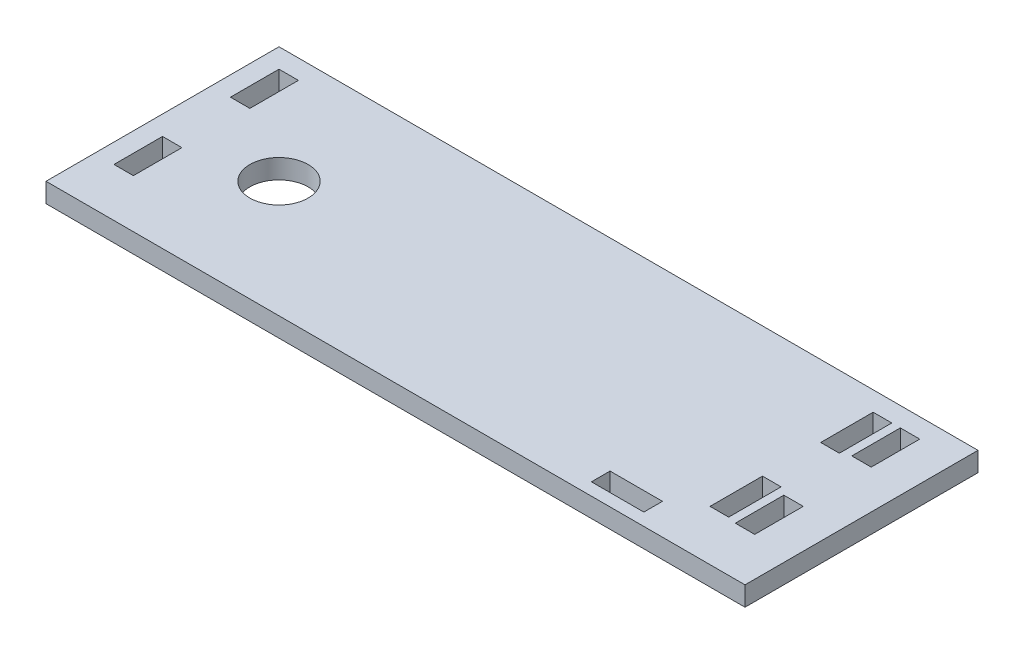
from build123d import *

# Parameters (mm, degrees)
SKETCH1_W           = 228.6
SKETCH1_H           = 76.2
SKETCH1_R           = 9.525
SKETCH1_W_2         = 6.35
SKETCH1_H_2         = 15.875
SKETCH1_W_3         = 6.096
SKETCH1_H_3         = 17.145
SKETCH1_W_4         = 17.145
SKETCH1_H_4         = 6.096
BOSS_EXTRUDE1_DEPTH = 6.35


with BuildPart() as part:
    # Sketch1 → Boss-Extrude1 (new body)
    with BuildSketch(Plane(origin=(0, 0, 0), x_dir=(1, 0, 0), z_dir=(0, 1, 0))):
        Rectangle(SKETCH1_W, SKETCH1_H)
        with Locations((-76.2, 0)):
            Circle(SKETCH1_R, mode=Mode.SUBTRACT)
        with Locations((-104.775, -14.2875)):
            Rectangle(SKETCH1_W_2, SKETCH1_H_2, mode=Mode.SUBTRACT)
        with Locations((-104.775, 23.8125)):
            Rectangle(SKETCH1_W_2, SKETCH1_H_2, mode=Mode.SUBTRACT)
        with Locations((89.408, -13.0175)):
            Rectangle(SKETCH1_W_3, SKETCH1_H_3, mode=Mode.SUBTRACT)
        with Locations((98.425, 23.8125)):
            Rectangle(SKETCH1_W_2, SKETCH1_H_2, mode=Mode.SUBTRACT)
        with Locations((98.425, -14.2875)):
            Rectangle(SKETCH1_W_2, SKETCH1_H_2, mode=Mode.SUBTRACT)
        with Locations((89.408, 23.1775)):
            Rectangle(SKETCH1_W_3, SKETCH1_H_3, mode=Mode.SUBTRACT)
        with Locations((68.58, -30.988)):
            Rectangle(SKETCH1_W_4, SKETCH1_H_4, mode=Mode.SUBTRACT)
    extrude(amount=BOSS_EXTRUDE1_DEPTH)


solid = part.part
